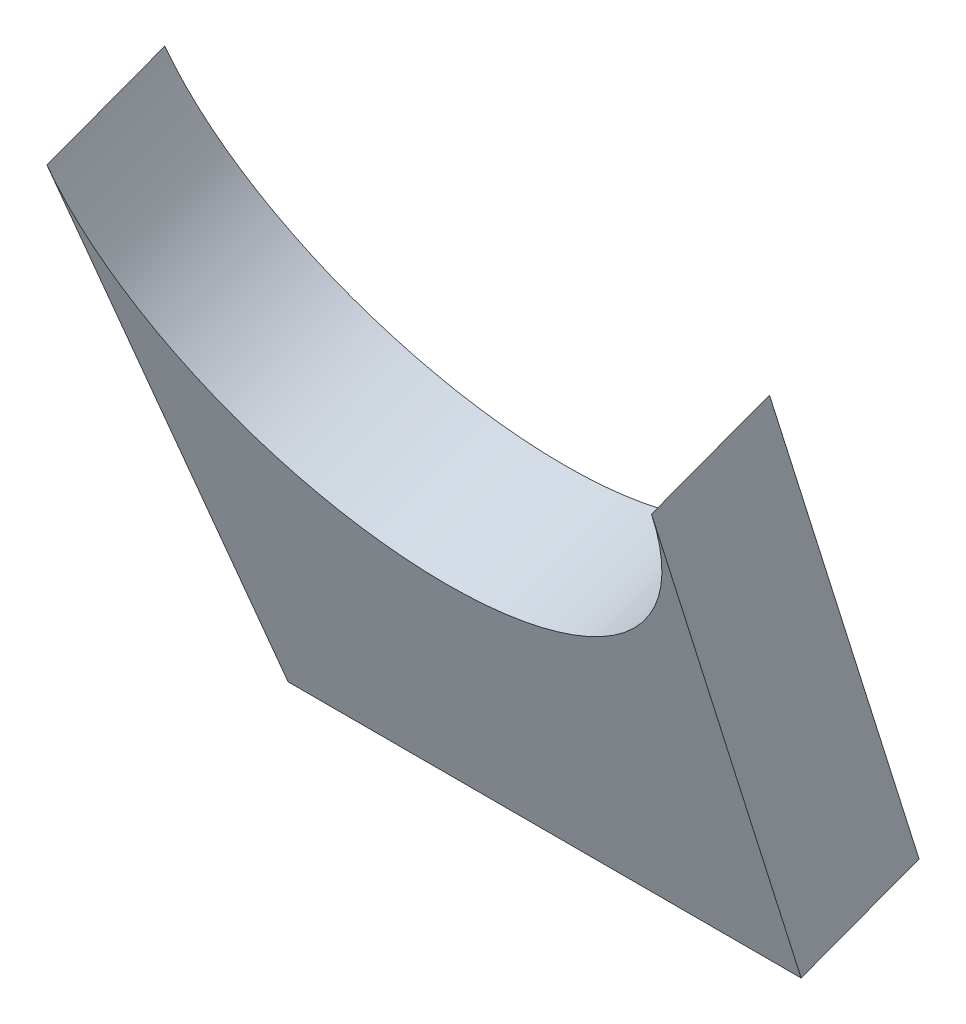
from build123d import *

# Parameters (mm, degrees)
BOSS_EXTRUDE3_DEPTH = 34.29


with BuildPart() as part:
    # Sketch4 → Boss-Extrude3 (new body)
    with BuildSketch(Plane(origin=(0, -48.929027825, 130.802863094), x_dir=(1, 0, 0), z_dir=(-1.1835613685518636e-15, -0.3503571552002775, 0.9366161774173927))):
        with BuildLine():
            Line((64.525230348, 336.071016896), (77.001077593, 184.182527419))
            Line((77.001077593, 184.182527419), (216.701077593, 184.182527419))
            Line((216.701077593, 184.182527419), (229.176924838, 336.071016896))
            ThreePointArc((229.176924838, 336.071016896), (146.851077593, 260.230020219), (64.525230348, 336.071016896))
        make_face()
    extrude(amount=BOSS_EXTRUDE3_DEPTH)


solid = part.part
